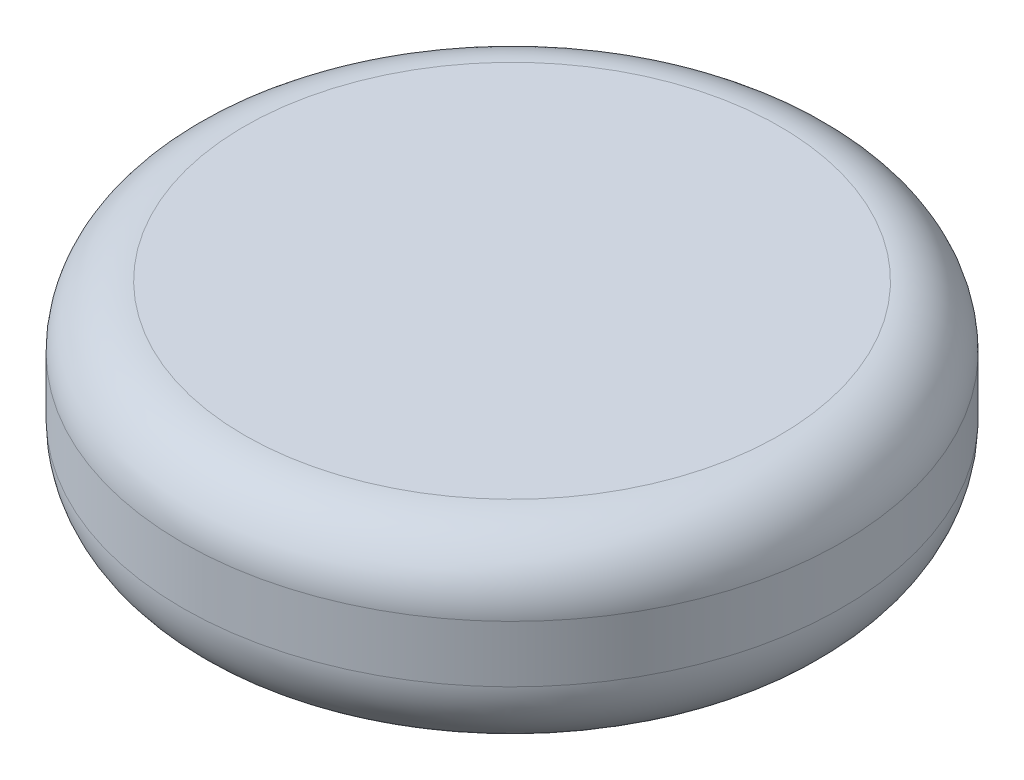
from build123d import *

# Parameters (mm, degrees)
SKETCH_4_R          = 250
EXTRUDE_2_DEPTH     = 150
FILLET_1_R          = 60
FILLET_2_R          = 47
SKETCH_16_R         = 190
CUT_EXTRUDE_1_DEPTH = 25
FILLET_3_R          = 25


with BuildPart() as part:
    # 草图4 → 凸台-拉伸2 (new body)
    with BuildSketch(Plane(origin=(0, 0, 0), x_dir=(1, 0, 0), z_dir=(0, 1, 0))):
        with Locations(Location((0, 0, 0), (0, 0, 270))):
            Circle(SKETCH_4_R)
    extrude(amount=EXTRUDE_2_DEPTH)

    # 圆角1
    fillet_1_edges = [part.edges().sort_by_distance(p)[0] for p in [
        (0, 0, -250),
    ]]
    fillet(fillet_1_edges, radius=FILLET_1_R)

    # 圆角2
    fillet_2_edges = [part.edges().sort_by_distance(p)[0] for p in [
        (0, 150, -250),
    ]]
    fillet(fillet_2_edges, radius=FILLET_2_R)

    # 草图16 → 切除-拉伸1 (cut)
    with BuildSketch(Plane(origin=(0, 0, 0), x_dir=(1, 0, 0), z_dir=(0, 1, 0))):
        with Locations(Location((0, 0, 0), (0, 0, 270))):
            Circle(SKETCH_16_R)
    extrude(amount=CUT_EXTRUDE_1_DEPTH, mode=Mode.SUBTRACT)

    # 圆角3
    # the kernel refuses this fillet: 25 mm, written as the material it takes off along each edge
    with BuildSketch(Plane(origin=(0, 0, 0), x_dir=(0, 0, 1), z_dir=(-1, 0, 0))) as fillet_3_piece_1:
        with BuildLine():
            CenterArc((213.35124434, 33.928571429), FILLET_3_R, 200.924832428, 110.924832428)
            Line((190, 25), (189.532975113, 24.821428571))
            ThreePointArc((189.532975113, 24.821428571), (189.5, 12.5), (189.5, 0))
            Line((189.5, 0), (190, -0.5))
            ThreePointArc((190, -0.5), (211.607142857, 3.489988696), (230.364293788, 14.933673469))
            Line((230.364293788, 14.933673469), (230.030704584, 15.306122449))
        make_face()
    revolve(axis=Axis((0, 0, 0), (0, 1, 0)), mode=Mode.SUBTRACT)

    # 倒角1
    # the kernel refuses this chamfer: 17.333818879, 10 mm, written as the material it adds along each edge
    with BuildSketch(Plane(origin=(0, 25, 0), x_dir=(0, 0, 1), z_dir=(-1, 0, 0))) as chamfer_1_piece_1:
        with BuildLine():
            Line((197.061199814, -10.000793021), (184.322097601, 0.439495442))
            Line((184.322097601, 0.439495442), (184.322097601, 0.786171819))
            ThreePointArc((184.322097601, 0.786171819), (187.161048801, 0.346676378), (190, 0.346676378))
            Line((190, 0.346676378), (190.323812992, 0.123812992))
            ThreePointArc((190.323812992, 0.123812992), (193.180553266, -5.246391965), (197.294531196, -9.744392989))
            Line((197.294531196, -9.744392989), (197.061199814, -10.000793021))
        make_face()
    revolve(axis=Axis((0, 25, 0), (0, 1, 0)))


solid = part.part
